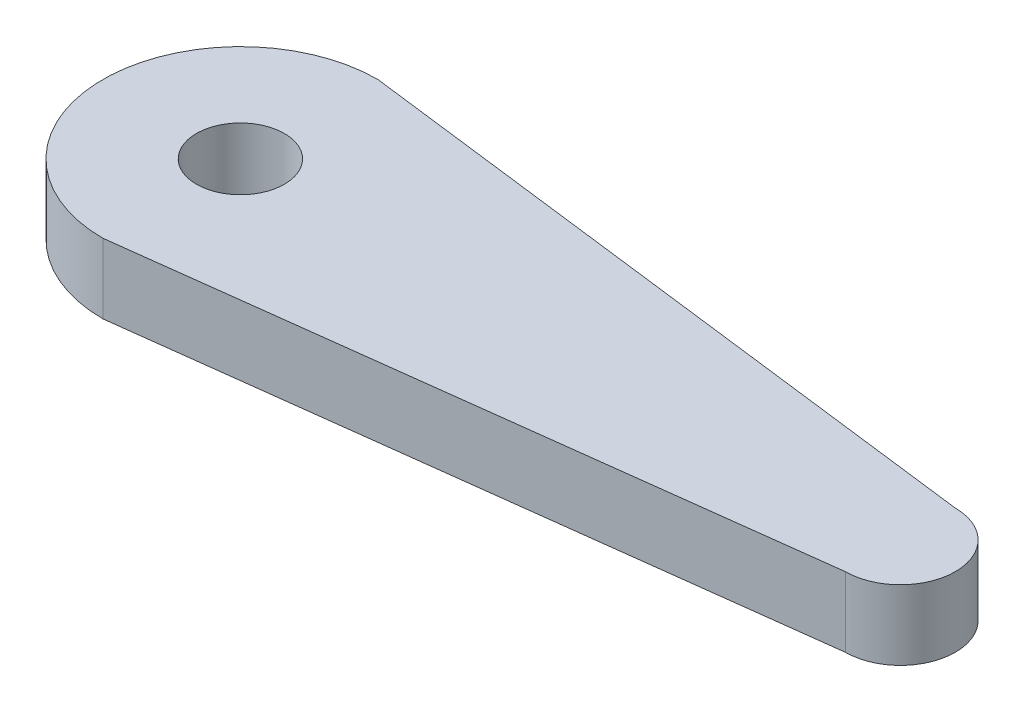
from build123d import *

# Parameters (mm, degrees)
SKETCH1_R           = 4
BOSS_EXTRUDE1_DEPTH = 6.35


with BuildPart() as part:
    # Sketch1 → Boss-Extrude1 (new body)
    with BuildSketch(Plane(origin=(0, 0, 0), x_dir=(1, 0, 0), z_dir=(0, 1, 0))):
        with BuildLine():
            Line((3.076923077, 12.115384615), (0, 12.5))
            ThreePointArc((0, 12.5), (-12.5, 0), (0, -12.5))
            Line((0, -12.5), (3.076923077, -12.115384615))
            Line((3.076923077, -12.115384615), (60, -5))
            ThreePointArc((60, -5), (65, 0), (60, 5))
            Line((60, 5), (3.076923077, 12.115384615))
        make_face()
        Circle(SKETCH1_R, mode=Mode.SUBTRACT)
    extrude(amount=BOSS_EXTRUDE1_DEPTH)


solid = part.part
